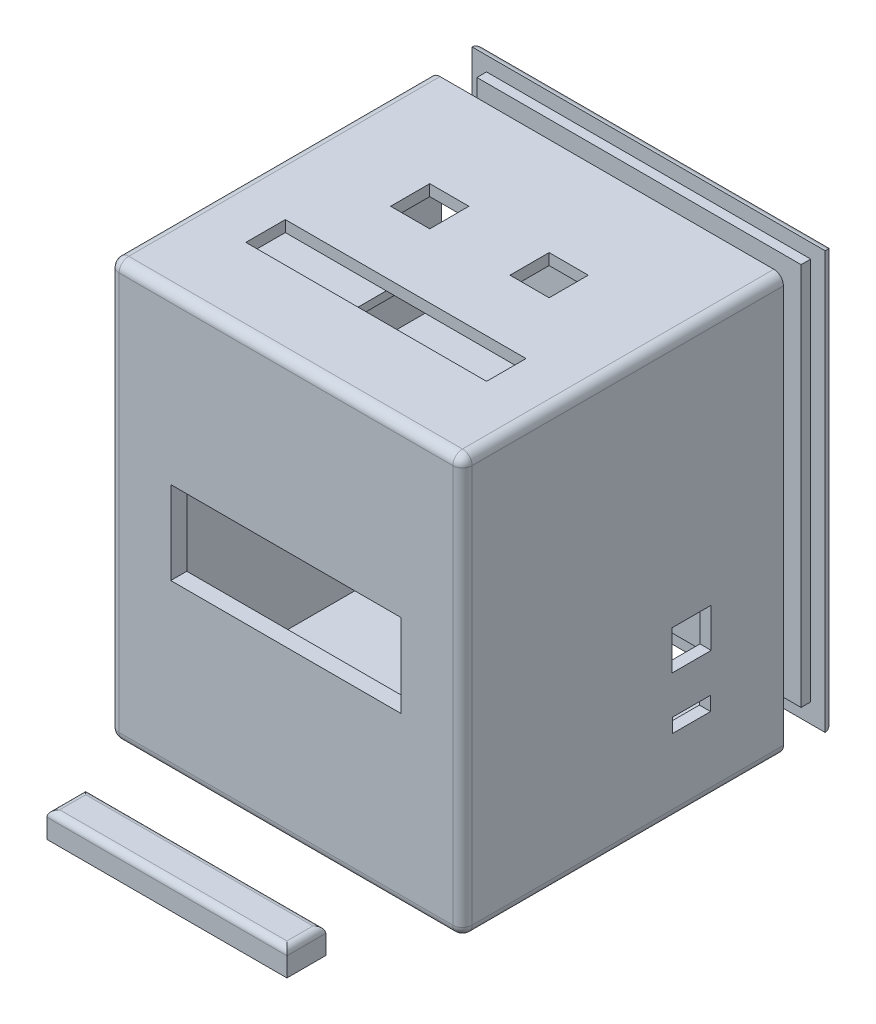
from build123d import *

# Parameters (mm, degrees)
SKETCH1_W           = 110
SKETCH1_H           = 100
BOSS_EXTRUDE1_DEPTH = 130
SKETCH2_W           = 103
SKETCH2_H           = 121.5
CUT_EXTRUDE1_DEPTH  = 95
SKETCH3_W           = 71.8
SKETCH3_H           = 25.9
CUT_EXTRUDE2_DEPTH  = 5
SKETCH4_W           = 75
SKETCH4_H           = 12.3
SKETCH4_W_2         = 12.2
SKETCH4_H_2         = 12.2
CUT_EXTRUDE3_DEPTH  = 3.5
SKETCH5_W           = 101
SKETCH5_H           = 119.5
BOSS_EXTRUDE2_DEPTH = 3
SKETCH7_W           = 110
SKETCH7_H           = 130
BOSS_EXTRUDE3_DEPTH = 3
SKETCH8_W           = 11.8
SKETCH8_H           = 4.4
SKETCH8_W_2         = 12.2
SKETCH8_H_2         = 12.2
CUT_EXTRUDE4_DEPTH  = 3.5
SKETCH9_W           = 9.8
SKETCH9_H           = 12.1
CUT_EXTRUDE5_DEPTH  = 6
SKETCH10_W          = 74.8
SKETCH10_H          = 12.1
BOSS_EXTRUDE4_DEPTH = 8
SKETCH11_R          = 3.35
CUT_EXTRUDE6_DEPTH  = 3.5
FILLET1_R           = 3
FILLET2_R           = 3
FILLET3_R           = 2
SKETCH13_W          = 35
SKETCH13_H          = 20
BOSS_EXTRUDE5_DEPTH = 2.5


with BuildPart() as part:
    # Sketch1 → Boss-Extrude1 (new body)
    with BuildSketch(Plane(origin=(0, 0, 0), x_dir=(1, 0, 0), z_dir=(0, 1, 0))):
        with Locations((55, 50)):
            Rectangle(SKETCH1_W, SKETCH1_H)
    extrude(amount=BOSS_EXTRUDE1_DEPTH)

    # Sketch2 → Cut-Extrude1 (cut)
    with BuildSketch(Plane(origin=(0, 0, -100), x_dir=(-1, 0, 0), z_dir=(0, 0, -1))):
        with Locations((-55, 65.75)):
            Rectangle(SKETCH2_W, SKETCH2_H)
    extrude(amount=-CUT_EXTRUDE1_DEPTH, mode=Mode.SUBTRACT)

    # Sketch3 → Cut-Extrude2 (cut)
    with BuildSketch(Plane.XY):
        with Locations((55, 65)):
            Rectangle(SKETCH3_W, SKETCH3_H)
    extrude(amount=-CUT_EXTRUDE2_DEPTH, mode=Mode.SUBTRACT)

    # Sketch4 → Cut-Extrude3 (cut)
    with BuildSketch(Plane(origin=(0, 130, 0), x_dir=(1, 0, 0), z_dir=(0, 1, 0))):
        with Locations((55, 31.15)):
            Rectangle(SKETCH4_W, SKETCH4_H)
        with Locations((73.6, 63.4)):
            Rectangle(SKETCH4_W_2, SKETCH4_H_2)
        with Locations((36.4, 63.4)):
            Rectangle(SKETCH4_W_2, SKETCH4_H_2)
    extrude(amount=-CUT_EXTRUDE3_DEPTH, mode=Mode.SUBTRACT)

    # Sketch8 → Cut-Extrude4 (cut)
    with BuildSketch(Plane(origin=(110, 0, 0), x_dir=(0, 0, -1), z_dir=(1, 0, 0))):
        with Locations((71.4, 25.7)):
            Rectangle(SKETCH8_W, SKETCH8_H)
        with Locations((71.4, 46)):
            Rectangle(SKETCH8_W_2, SKETCH8_H_2)
    extrude(amount=-CUT_EXTRUDE4_DEPTH, mode=Mode.SUBTRACT)

    # Fillet1
    fillet1_edges = [part.edges().sort_by_distance(p)[0] for p in [
        (110, 130, -50),
        (55, 5, -5),
        (0, 130, -50),
        (110, 0, -50),
        (55, 0, 0),
        (0, 0, -50),
        (110, 65, 0),
        (0, 65, 0),
        (55, 130, 0),
    ]]
    fillet(fillet1_edges, radius=FILLET1_R)

    # Sketch13 → Boss-Extrude5 (add)
    with BuildSketch(Plane.XZ.offset(-126.5)):
        with Locations((31.45, -31.15)):
            Rectangle(SKETCH13_W, SKETCH13_H)
        with Locations((78.55, -31.15)):
            Rectangle(SKETCH13_W, SKETCH13_H)
    extrude(amount=BOSS_EXTRUDE5_DEPTH)


with BuildPart() as body_2:
    # Sketch5 → Boss-Extrude2 (new body)
    with BuildSketch(Plane(origin=(0, 0, -110), x_dir=(-1, 0, 0), z_dir=(0, 0, -1))):
        with Locations((-55, 65.75)):
            Rectangle(SKETCH5_W, SKETCH5_H)
    extrude(amount=BOSS_EXTRUDE2_DEPTH)

    # Sketch7 → Boss-Extrude3 (add)
    with BuildSketch(Plane(origin=(0, 0, -113), x_dir=(-1, 0, 0), z_dir=(0, 0, -1))):
        with Locations((-55, 65)):
            Rectangle(SKETCH7_W, SKETCH7_H)
    extrude(amount=BOSS_EXTRUDE3_DEPTH)

    # Sketch9 → Cut-Extrude5 (cut)
    with BuildSketch(Plane(origin=(0, 0, -116), x_dir=(-1, 0, 0), z_dir=(0, 0, -1))):
        with Locations((-81.1, 29.65)):
            Rectangle(SKETCH9_W, SKETCH9_H)
    extrude(amount=-CUT_EXTRUDE5_DEPTH, mode=Mode.SUBTRACT)

    # Fillet2
    fillet2_edges = [body_2.edges().sort_by_distance(p)[0] for p in [
        (55, 0, -116),
        (110, 65, -116),
        (0, 65, -116),
        (55, 130, -116),
    ]]
    fillet(fillet2_edges, radius=FILLET2_R - 0.0001)  # a hair under: the kernel refuses the full size


with BuildPart() as body_3:
    # Sketch10 → Boss-Extrude4 (new body)
    with BuildSketch(Plane(origin=(0, 0, 0), x_dir=(1, 0, 0), z_dir=(0, 1, 0))):
        with Locations((55, -31.05)):
            Rectangle(SKETCH10_W, SKETCH10_H)
    extrude(amount=BOSS_EXTRUDE4_DEPTH)

    # Sketch11 → Cut-Extrude6 (cut)
    with BuildSketch(Plane.XZ):
        with Locations(Location((55, 31.05, 0), (0, 0, 270))):
            Circle(SKETCH11_R)
    extrude(amount=-CUT_EXTRUDE6_DEPTH, mode=Mode.SUBTRACT)

    # Fillet3
    fillet3_edges = [body_3.edges().sort_by_distance(p)[0] for p in [
        (92.4, 8, 31.05),
        (55, 8, 25),
        (17.6, 8, 31.05),
        (55, 8, 37.1),
    ]]
    fillet(fillet3_edges, radius=FILLET3_R)


solid = Compound([part.part, body_2.part, body_3.part])
